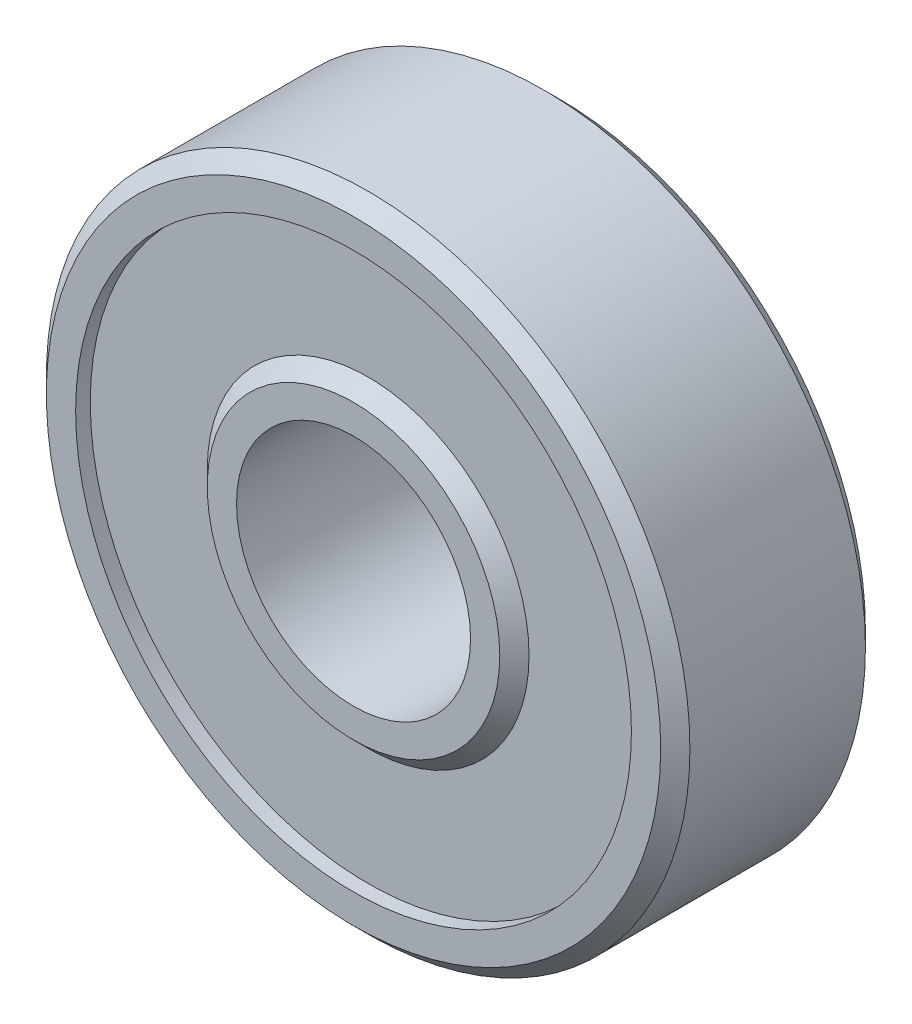
from build123d import *

# Parameters (mm, degrees)
SKETCH1_R             = 11
SKETCH1_R_2           = 9.5
BOSS_EXTRUDE1_DEPTH   = 3.5
SKETCH1_R_3           = 5.5
SKETCH1_R_4           = 4
BOSS_EXTRUDE1_2_DEPTH = 3.5
SKETCH1_3_R           = 9.5
SKETCH1_3_R_2         = 5.5
BOSS_EXTRUDE2_DEPTH   = 3
CHAMFER1_SIZE         = 0.5


with BuildPart() as part:
    # Sketch1 → Boss-Extrude1 (new, symmetric)
    with BuildSketch(Plane.XY):
        Circle(SKETCH1_R)
        Circle(SKETCH1_R_2, mode=Mode.SUBTRACT)
    extrude(amount=BOSS_EXTRUDE1_DEPTH, both=True)



with BuildPart() as body_2:
    # Sketch1 → Boss-Extrude1 2 (new, symmetric)
    with BuildSketch(Plane.XY):
        Circle(SKETCH1_R_3)
        Circle(SKETCH1_R_4, mode=Mode.SUBTRACT)
    extrude(amount=BOSS_EXTRUDE1_2_DEPTH, both=True)


with BuildPart() as part_1:
    add(part.part)

    add(body_2.part)  # Boss-Extrude2 merges body 2
    # Sketch1<3> → Boss-Extrude2 (add, symmetric)
    with BuildSketch(Plane.XY):
        Circle(SKETCH1_3_R)
        Circle(SKETCH1_3_R_2, mode=Mode.SUBTRACT)
    extrude(amount=BOSS_EXTRUDE2_DEPTH, both=True)

    # Chamfer1
    chamfer1_edges = [part_1.edges().sort_by_distance(p)[0] for p in [
        (-5.5, 0, -3.5),
        (-5.5, 0, 3.5),
        (-11, 0, -3.5),
        (-11, 0, 3.5),
    ]]
    chamfer(chamfer1_edges, length=CHAMFER1_SIZE - 0.0001)  # a hair under: the kernel refuses the full size


solid = part_1.part
